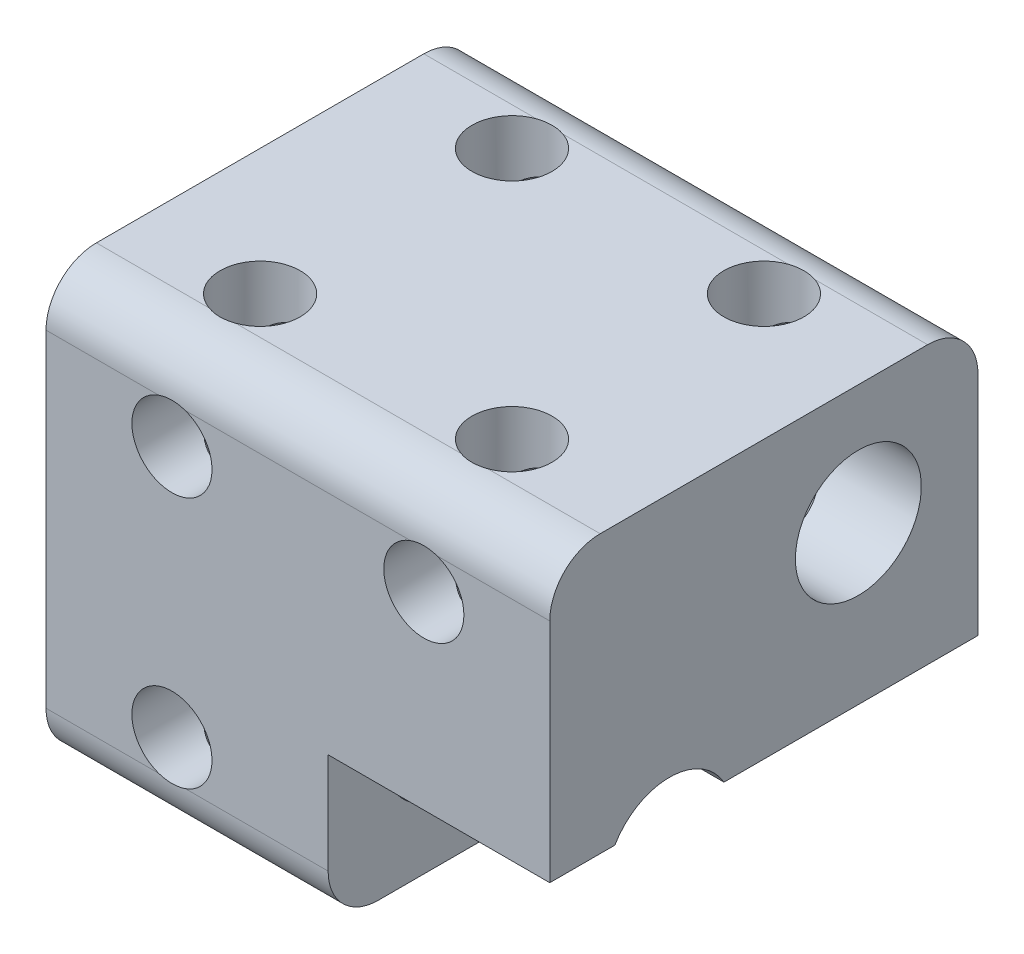
from build123d import *

# Parameters (mm, degrees)
BOSS_EXTRUDE1_DEPTH            = 25.4
F_1_4_0_2500_DOWEL_HOLE1_D     = 6.35
F_10_32_START                  = -10.795
F_10_32_TAPPED_HOLE2_OUTLINE_R = 2.0193
F_10_32_TAPPED_HOLE2_DEPTH     = 21.59
SKETCH8_W                      = 21.59
SKETCH8_H                      = 7.62
CUT_EXTRUDE1_DEPTH             = 11.176


# Read off the part's stored shape, not the designer's step: #10-32 Tapped Hole2
with BuildPart() as part:
    # Sketch1 → Boss-Extrude1 (new body)
    with BuildSketch(Plane(origin=(0, 0, 0), x_dir=(0, 0, -1), z_dir=(1, 0, 0))):
        with BuildLine():
            Line((8.255, -10.795), (-8.255, -10.795))
            ThreePointArc((-8.255, -10.795), (-10.051051224, -10.051051224), (-10.795, -8.255))
            Line((-10.795, -8.255), (-10.795, 8.255))
            ThreePointArc((-10.795, 8.255), (-10.051051224, 10.051051224), (-8.255, 10.795))
            Line((-8.255, 10.795), (8.255, 10.795))
            ThreePointArc((8.255, 10.795), (10.051051224, 10.051051224), (10.795, 8.255))
            Line((10.795, 8.255), (10.795, -8.255))
            ThreePointArc((10.795, -8.255), (10.051051224, -10.051051224), (8.255, -10.795))
        make_face()
    extrude(amount=BOSS_EXTRUDE1_DEPTH)

    # 1/4 (0.2500) Dowel Hole1 (through all)
    with Locations(Plane.ZY):
        with Locations((-4.7625, 4.7625), (4.7625, -4.7625)):
            Hole(F_1_4_0_2500_DOWEL_HOLE1_D / 2)

    # #10-32 Tapped Hole2 outline → #10-32 Tapped Hole2 (cut)
    with BuildSketch(Plane.XY.offset(F_10_32_START)):
        with Locations((19.05, -6.35)):
            Circle(F_10_32_TAPPED_HOLE2_OUTLINE_R)
        with Locations((6.35, -6.35)):
            Circle(F_10_32_TAPPED_HOLE2_OUTLINE_R)
        with Locations((19.05, 6.35)):
            Circle(F_10_32_TAPPED_HOLE2_OUTLINE_R)
        with Locations((6.35, 6.35)):
            Circle(F_10_32_TAPPED_HOLE2_OUTLINE_R)
    f_10_32_tapped_hole2 = extrude(amount=F_10_32_TAPPED_HOLE2_DEPTH, mode=Mode.SUBTRACT)

    # Mirror1: #10-32 Tapped Hole2 across plane
    add(f_10_32_tapped_hole2.mirror(Plane(origin=(0, 0, 0), x_dir=(0, 0.7071067811865478, 0.7071067811865472), z_dir=(0, -0.7071067811865475, 0.7071067811865477))), mode=Mode.SUBTRACT)

    # Sketch8 → Cut-Extrude1 (cut)
    with BuildSketch(Plane(origin=(25.4, 0, 0), x_dir=(0, 0, -1), z_dir=(1, 0, 0))):
        with Locations((0, -6.985)):
            Rectangle(SKETCH8_W, SKETCH8_H)
    extrude(amount=-CUT_EXTRUDE1_DEPTH, mode=Mode.SUBTRACT)


solid = part.part
